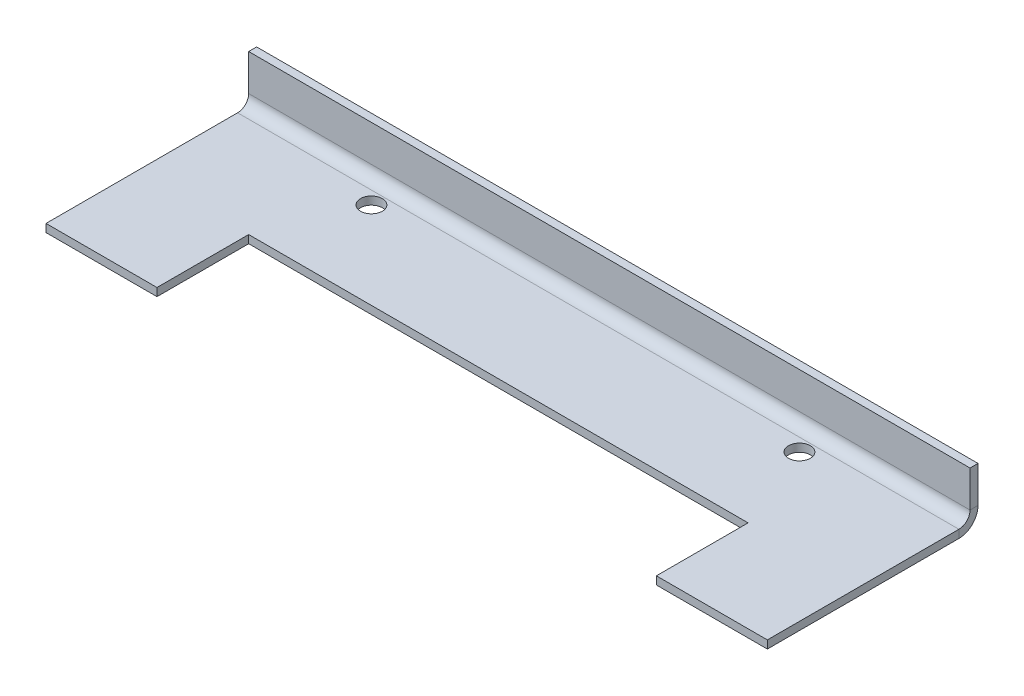
from build123d import *

# Parameters (mm, degrees)
BASE_FLANGE1_DEPTH           = 0.91186
F_2_5MM_DOWEL_HOLE1_D        = 2.5
EDGE_FLANGE1_STRIP_W         = 6.18744
EDGE_FLANGE1_STRIP_H         = 0.91186
EDGE_FLANGE1_STRIP_CUT_DEPTH = 82.55
EDGE_FLANGE1_DEPTH           = 82.55


# Sheet-metal steps are written as plain solids
with BuildPart() as part:
    # Sketch1 → Base-Flange1 (new body)
    with BuildSketch(Plane(origin=(0, 0, 0), x_dir=(1, 0, 0), z_dir=(0, 1, 0))):
        Polygon((0, -24.82463), (0, -48.018817445), (12.7, -48.018817445), (12.7, -37.52463), (69.85, -37.52463), (69.85, -48.018817445), (82.55, -48.018817445), (82.55, -24.82463), align=None)
    extrude(amount=-BASE_FLANGE1_DEPTH)

    # Ø2.5mm Dowel Hole1 (through all)
    with Locations(Plane(origin=(0, -0.91186, 0), x_dir=(-1, 0, 0), z_dir=(0, -1, 0))):
        with Locations((-65.76314, -27.56213), (-16.78686, -27.56213)):
            Hole(F_2_5MM_DOWEL_HOLE1_D / 2)

    # Edge-Flange1 strip (across the edge) → Edge-Flange1 strip cut (cut)
    with BuildSketch(Plane(origin=(82.55, 0, 24.82463), x_dir=(0, 0, 1), z_dir=(-1, 0, 0))):
        with Locations((-1.82372, -0.45593)):
            Rectangle(EDGE_FLANGE1_STRIP_W, EDGE_FLANGE1_STRIP_H)
    extrude(amount=EDGE_FLANGE1_STRIP_CUT_DEPTH, mode=Mode.SUBTRACT)

    # Edge-Flange1 section (across the edge) → Edge-Flange1 (add)
    with BuildSketch(Plane(origin=(82.55, 0, 24.82463), x_dir=(0, 0, 1), z_dir=(-1, 0, 0))):
        with BuildLine():
            Line((-0.91186, 1.27), (-0.91186, 5.43814))
            Line((-0.91186, 5.43814), (0, 5.43814))
            Line((0, 5.43814), (0, 1.27))
            ThreePointArc((0, 1.27), (0.371974388, 0.371974388), (1.27, 0))
            Line((1.27, 0), (1.27, -0.91186))
            ThreePointArc((1.27, -0.91186), (-0.272808002, -0.272808002), (-0.91186, 1.27))
        make_face()
    extrude(amount=EDGE_FLANGE1_DEPTH)


solid = part.part
